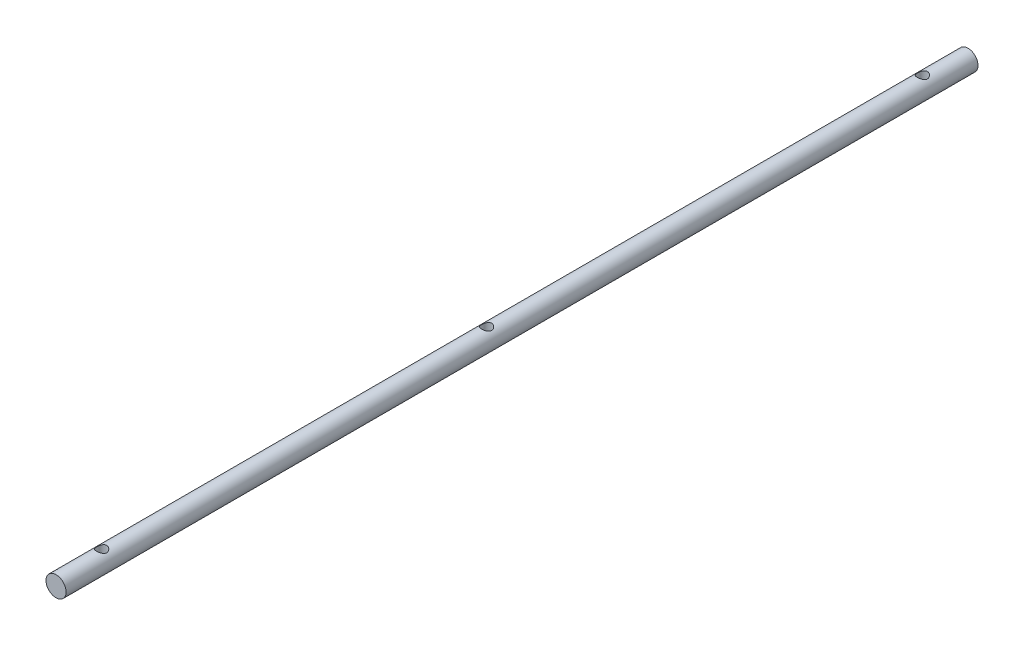
from build123d import *

# Parameters (mm, degrees)
SKETCH2_R               = 1.985
BOSS_EXTRUDE1_DEPTH     = 180
CUT_EXTRUDE1_DEPTH      = 181.021888808
CUT_EXTRUDE1_DEPTH_BACK = 181.021888808
SKETCH4_R               = 1


with BuildPart() as part:
    # Sketch2 → Boss-Extrude1 (new body)
    with BuildSketch(Plane.XY):
        Circle(SKETCH2_R)
    extrude(amount=BOSS_EXTRUDE1_DEPTH)

    # Sketch4 → Cut-Extrude1 (cut, two sides: drawn at the far end of the back side and taken through both)
    with BuildSketch(Plane(origin=(0, 0, 0), x_dir=(1, 0, 0), z_dir=(0, 1, 0)).offset(-CUT_EXTRUDE1_DEPTH_BACK)):
        with Locations((0, -171)):
            Circle(SKETCH4_R)
        with Locations((0, -9)):
            Circle(SKETCH4_R)
        with Locations((0, -95.02)):
            Circle(SKETCH4_R)
    extrude(amount=CUT_EXTRUDE1_DEPTH + CUT_EXTRUDE1_DEPTH_BACK, mode=Mode.SUBTRACT)


solid = part.part
